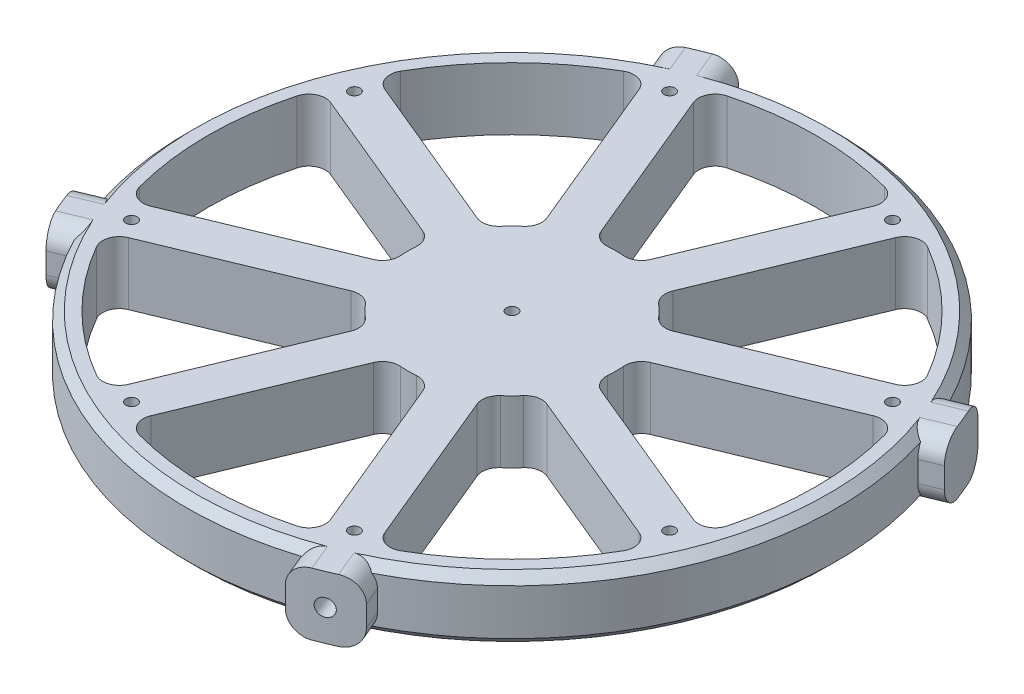
from build123d import *

# Parameters (mm, degrees)
F_6_32_TAPPED_HOLE2_D    = 2.7051
CIRPATTERN3_COUNT        = 8
CUT_EXTRUDE1_DEPTH       = 112.4638590935026
FILLET1_R                = 4
CIRPATTERN4_COUNT        = 8
FILLET1_OF_CIRPATTERN4_R = 4
F_6_32_TAPPED_HOLE1_D    = 2.7051
BOSS_EXTRUDE1_DEPTH      = 15
FILLET2_R                = 5
CIRPATTERN5_COUNT        = 4
FILLET2_OF_CIRPATTERN5_R = 5
CHAMFER1_SIZE            = 2


with BuildPart() as part:
    # Sketch2 → Revolve1 (revolve)
    with BuildSketch(Plane(origin=(0, 0, 0), x_dir=(0, 0, -1), z_dir=(1, 0, 0))):
        Polygon((0, 0), (-78.09991000000001, -9.56e-15), (-78.09991000000001, 14.99999999999999), (0, 14.99999999999999), align=None)
    revolve(axis=Axis((0, -1.095249858647596, 0), (0, 1, 0)))

    # #6-32 Tapped Hole2 (through all)
    with Locations(Plane(origin=(0, 14.99999999999999, 0), x_dir=(1, 0, 0), z_dir=(0, 1, 0))):
        with Locations((-26.787840266, 64.671567276)):
            f_6_32_tapped_hole2 = Hole(F_6_32_TAPPED_HOLE2_D / 2)

    # CirPattern3: #6-32 Tapped Hole2 ×8 about axis
    cirpattern3_axis = Axis((0, -1.095249858647596, 0), (0, 1, 0))
    for i in range(1, CIRPATTERN3_COUNT):
        add(f_6_32_tapped_hole2.rotate(cirpattern3_axis, i * 360 / CIRPATTERN3_COUNT), mode=Mode.SUBTRACT)

    # Sketch8 → Cut-Extrude1 (cut, through all)
    with BuildSketch(Plane(origin=(0, 14.99999999999999, 0), x_dir=(1, 0, 0), z_dir=(0, 1, 0))):
        with BuildLine():
            Line((-4.7543937605570585, 24.54375154636259), (-23.289211659898342, 69.29076029506788))
            ThreePointArc((-23.289211659898342, 69.29076029506788), (4.48e-15, 73.09991000000001), (23.289211659898342, 69.29076029506788))
            Line((23.289211659898342, 69.29076029506788), (4.7543937605570585, 24.54375154636259))
            ThreePointArc((4.7543937605570585, 24.54375154636259), (1.53e-15, 24.999999999999996), (-4.7543937605570585, 24.54375154636259))
        make_face()
    cut_extrude1 = extrude(amount=-CUT_EXTRUDE1_DEPTH, mode=Mode.SUBTRACT)

    # Fillet1
    fillet1_edges = [part.edges().sort_by_distance(p)[0] for p in [
        (4.754393760557059, 7.499999999999995, -24.543751546362593),
        (23.289211659898342, 7.499999999999995, -69.29076029506788),
        (-4.754393760557059, 7.499999999999995, -24.543751546362593),
        (-23.289211659898346, 7.499999999999995, -69.29076029506788),
    ]]
    fillet(fillet1_edges, radius=FILLET1_R)

    # CirPattern4: Cut-Extrude1 ×8 about axis
    cirpattern4_axis = Axis((0, -1.095249858647596, 0), (0, 1, 0))
    for i in range(1, CIRPATTERN4_COUNT):
        add(cut_extrude1.rotate(cirpattern4_axis, i * 360 / CIRPATTERN4_COUNT), mode=Mode.SUBTRACT)

    # Fillet1 of CirPattern4
    fillet1_of_cirpattern4_edges = [part.edges().sort_by_distance(p)[0] for p in [
        (-13.99318908566989, 7.499999999999995, -20.71691722271171),
        (-32.528006985011146, 7.499999999999995, -65.46392597141701),
        (-20.716917222711707, 7.499999999999995, -13.993189085669895),
        (-65.46392597141701, 7.499999999999995, -32.52800698501116),
        (-24.543751546362593, 7.499999999999995, -4.754393760557061),
        (-69.29076029506788, 7.499999999999995, -23.289211659898346),
        (-24.543751546362593, 7.499999999999995, 4.754393760557058),
        (-69.29076029506788, 7.499999999999995, 23.289211659898342),
        (-20.71691722271171, 7.499999999999995, 13.99318908566989),
        (-65.46392597141701, 7.499999999999995, 32.528006985011146),
        (-13.993189085669895, 7.499999999999995, 20.716917222711707),
        (-32.52800698501116, 7.499999999999995, 65.46392597141701),
        (-4.754393760557062, 7.499999999999995, 24.543751546362593),
        (-23.28921165989835, 7.499999999999995, 69.29076029506788),
        (4.754393760557057, 7.499999999999995, 24.543751546362593),
        (23.28921165989834, 7.499999999999995, 69.29076029506788),
        (13.99318908566989, 7.499999999999995, 20.716917222711714),
        (32.528006985011146, 7.499999999999995, 65.46392597141701),
        (20.716917222711707, 7.499999999999995, 13.993189085669899),
        (65.46392597141701, 7.499999999999995, 32.52800698501116),
        (24.543751546362593, 7.499999999999995, 4.754393760557064),
        (69.29076029506788, 7.499999999999995, 23.289211659898356),
        (24.543751546362593, 7.499999999999995, -4.754393760557055),
        (69.29076029506788, 7.499999999999995, -23.28921165989833),
        (20.71691722271171, 7.499999999999995, -13.99318908566989),
        (65.46392597141701, 7.499999999999995, -32.52800698501114),
        (13.993189085669899, 7.499999999999995, -20.716917222711707),
        (32.52800698501117, 7.499999999999995, -65.46392597141701),
    ]]
    fillet(fillet1_of_cirpattern4_edges, radius=FILLET1_OF_CIRPATTERN4_R)

    # #6-32 Tapped Hole1 (through all)
    with Locations(Plane(origin=(0, 0, 0), x_dir=(-1, 0, 0), z_dir=(0, -1, 0))):
        with Locations((0, 0)):
            Hole(F_6_32_TAPPED_HOLE1_D / 2)

    # Sketch12 → Boss-Extrude1 (add)
    with BuildSketch(Plane(origin=(0, 14.99999999999999, 0), x_dir=(1, 0, 0), z_dir=(0, 1, 0))):
        with BuildLine():
            Line((-22.868349414760402, 74.67686748285931), (-24.743498233349346, 79.20387719216461))
            ThreePointArc((-24.743498233349346, 79.20387719216461), (-31.754643398619994, 76.66249076126954), (-38.50930326776752, 73.50189404992476))
            Line((-38.50930326776752, 73.50189404992476), (-36.63415444917859, 68.97488434061945))
            ThreePointArc((-36.63415444917859, 68.97488434061945), (-29.887541626204644, 72.15490833997356), (-22.868349414760402, 74.67686748285931))
        make_face()
    boss_extrude1 = extrude(amount=-BOSS_EXTRUDE1_DEPTH)

    # Fillet2
    fillet2_edges = [part.edges().sort_by_distance(p)[0] for p in [
        (-23.805923824054872, 14.99999999999999, -76.94037233751196),
        (-37.57172885847305, 14.99999999999999, -71.2383891952721),
        (-23.805923824054872, -1.066e-14, -76.94037233751196),
        (-37.57172885847305, -1.066e-14, -71.2383891952721),
    ]]
    fillet(fillet2_edges, radius=FILLET2_R)

    # CirPattern5: Boss-Extrude1 ×4 about axis
    cirpattern5_axis = Axis((0, -1.095249858647596, 0), (0, 1, 0))
    for i in range(1, CIRPATTERN5_COUNT):
        add(boss_extrude1.rotate(cirpattern5_axis, i * 360 / CIRPATTERN5_COUNT))

    # Fillet2 of CirPattern5
    fillet2_of_cirpattern5_edges = [part.edges().sort_by_distance(p)[0] for p in [
        (-76.94037233751196, 14.99999999999999, 23.80592382405487),
        (-71.2383891952721, 14.99999999999999, 37.571728858473044),
        (-76.94037233751196, -1.066e-14, 23.80592382405487),
        (-71.2383891952721, -1.066e-14, 37.571728858473044),
        (23.80592382405486, 14.99999999999999, 76.94037233751196),
        (37.571728858473044, 14.99999999999999, 71.2383891952721),
        (23.80592382405486, -1.066e-14, 76.94037233751196),
        (37.571728858473044, -1.066e-14, 71.2383891952721),
        (76.94037233751196, 14.99999999999999, -23.805923824054858),
        (71.2383891952721, 14.99999999999999, -37.57172885847304),
        (76.94037233751196, -1.066e-14, -23.805923824054858),
        (71.2383891952721, -1.066e-14, -37.57172885847304),
    ]]
    fillet(fillet2_of_cirpattern5_edges, radius=FILLET2_OF_CIRPATTERN5_R)

    # Chamfer1
    chamfer1_edges = [part.edges().sort_by_distance(p)[0] for p in [
        (72.15490833997359, 2.645e-14, 29.88754162620456),
        (-29.887541626204555, 8.82e-15, 72.1549083399736),
        (-72.1549083399736, 8.82e-15, -29.887541626204555),
        (-72.1549083399736, 14.99999999999997, -29.887541626204555),
        (-29.887541626204555, 14.99999999999997, 72.1549083399736),
        (72.15490833997359, 14.99999999999997, 29.88754162620456),
        (29.887541626204577, 2.645e-14, -72.1549083399736),
        (29.887541626204577, 14.99999999999997, -72.1549083399736),
    ]]
    chamfer(chamfer1_edges, length=CHAMFER1_SIZE)

    # Sketch15 → #20 (0.161) Diameter Hole1 (revolve, cut)
    with BuildSketch(Plane(origin=(0, 7.5, 0), x_dir=(-0.9238795325112864, 0, 0.38268343236509056), z_dir=(0, 1, 0))):
        Polygon((0, 0), (-2.544e-14, 103.85534001771212), (2.0446999999999744, 103.85534001771212), (2.0446999999999877, -1.3e-15), align=None)
    revolve(axis=Axis((-2.4300397955183217, 7.5, -5.866635031446661), (0.38268343236509056, 0, 0.9238795325112865)), mode=Mode.SUBTRACT)


solid = part.part
